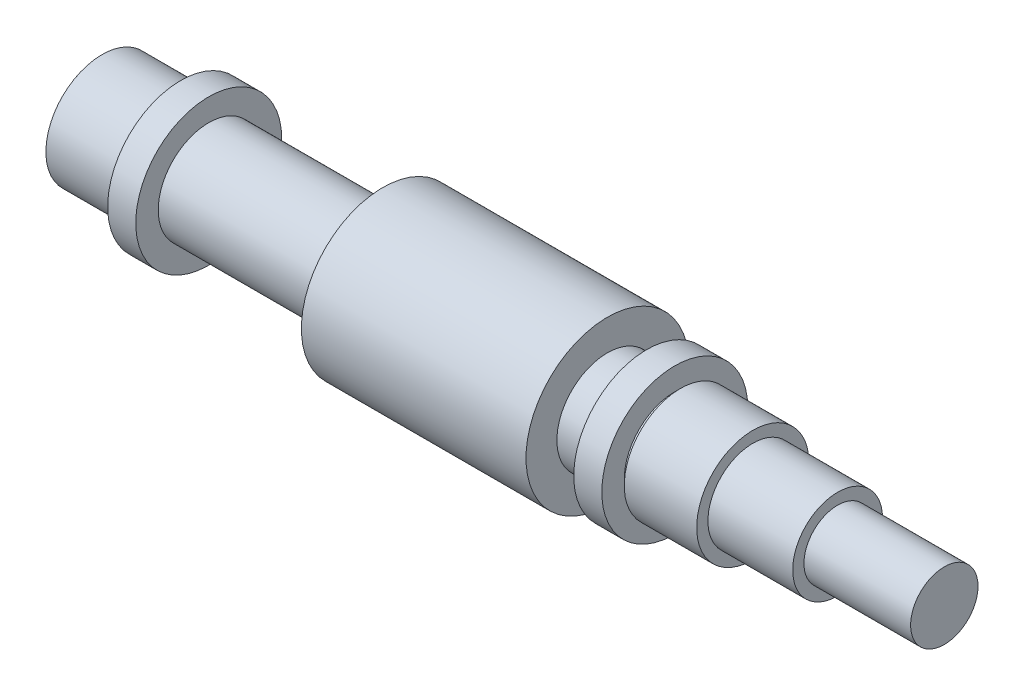
from build123d import *


with BuildPart() as part:
    # 草图1 → 旋转1 (revolve)
    with BuildSketch(Plane.XY):
        Polygon((0, 0), (0, 10), (13, 10), (13, 9), (14, 9), (14, 13), (19, 13), (19, 9), (50, 9), (50, 14.5), (90, 14.5), (90, 9), (97, 9), (97, 13), (102, 13), (102, 9), (103, 9), (103, 10), (115.9, 10), (115.9, 8), (131, 8), (131, 6), (150, 6), (150, 0), align=None)
    revolve(axis=Axis((0, 0, 0), (-1, 0, 0)))


solid = part.part
